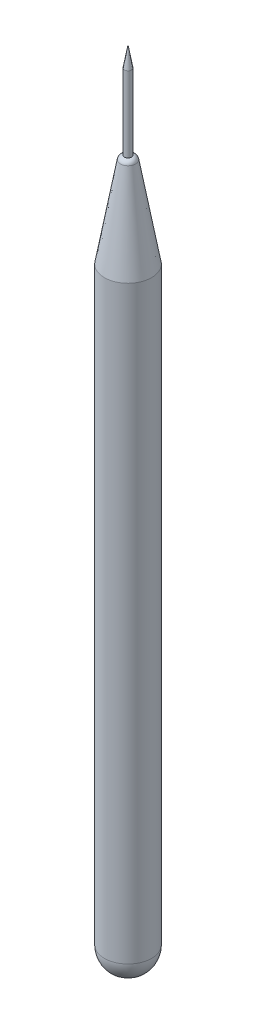
from build123d import *

# Parameters (mm, degrees)
SKETCH1_R           = 5
BOSS_EXTRUDE1_DEPTH = 75
CHAMFER1_SIZE       = 20
CHAMFER1_SIZE2      = 3.526539614
FILLET1_R           = 5
SKETCH2_R           = 0.75
BOSS_EXTRUDE2_DEPTH = 20
CHAMFER2_SIZE       = 4
CHAMFER2_SIZE2      = 0.705307923
FILLET2_R           = 1


with BuildPart() as part:
    # Sketch1 → Boss-Extrude1 (new, symmetric)
    with BuildSketch(Plane(origin=(0, 0, 0), x_dir=(1, 0, 0), z_dir=(0, 1, 0))):
        with Locations(Location((0, 0, 0), (0, 0, 270))):
            Circle(SKETCH1_R)
    extrude(amount=BOSS_EXTRUDE1_DEPTH, both=True)

    # Chamfer1
    chamfer1_edges = [part.edges().sort_by_distance(p)[0] for p in [
        (0, 75, -5),
    ]]
    chamfer1_side = [part.faces().sort_by_distance(p)[0] for p in [
        (0, 0, -5),
    ]]
    chamfer(chamfer1_edges, length=CHAMFER1_SIZE, length2=CHAMFER1_SIZE2, reference=chamfer1_side[0])

    # Fillet1
    fillet1_edges = [part.edges().sort_by_distance(p)[0] for p in [
        (0, -75, -5),
    ]]
    fillet(fillet1_edges, radius=FILLET1_R)

    # Sketch2 → Boss-Extrude2 (add)
    with BuildSketch(Plane(origin=(0, 75, 0), x_dir=(1, 0, 0), z_dir=(0, 1, 0))):
        with Locations(Location((0, 0, 0), (0, 0, 270))):
            Circle(SKETCH2_R)
    extrude(amount=BOSS_EXTRUDE2_DEPTH)

    # Chamfer2
    chamfer2_edges = [part.edges().sort_by_distance(p)[0] for p in [
        (0, 95, -0.75),
    ]]
    chamfer2_side = [part.faces().sort_by_distance(p)[0] for p in [
        (0, 85, -0.75),
    ]]
    chamfer(chamfer2_edges, length=CHAMFER2_SIZE, length2=CHAMFER2_SIZE2, reference=chamfer2_side[0])

    # Fillet2
    # the kernel refuses this fillet: 1 mm, written as the material it takes off along each edge
    with BuildSketch(Plane(origin=(0, 75, 0), x_dir=(0, 0, 1), z_dir=(-1, 0, 0))) as fillet2_piece_1:
        with BuildLine():
            CenterArc((0.6331529, -0.993149916), FILLET2_R, 10, 73.289825559)
            Line((1.617960653, -0.819501738), (1.637656808, -0.816028775))
            Line((1.637656808, -0.816028775), (1.493156541, 0.003472964))
            Line((1.493156541, 0.003472964), (1.473460386, 0.02))
            ThreePointArc((1.473460386, 0.02), (1.111730193, 0.02), (0.752336942, 0.019862998))
            Line((0.752336942, 0.019862998), (0.75, 0))
        make_face()
    revolve(axis=Axis((0, 75, 0), (0, 1, 0)), mode=Mode.SUBTRACT)


solid = part.part
